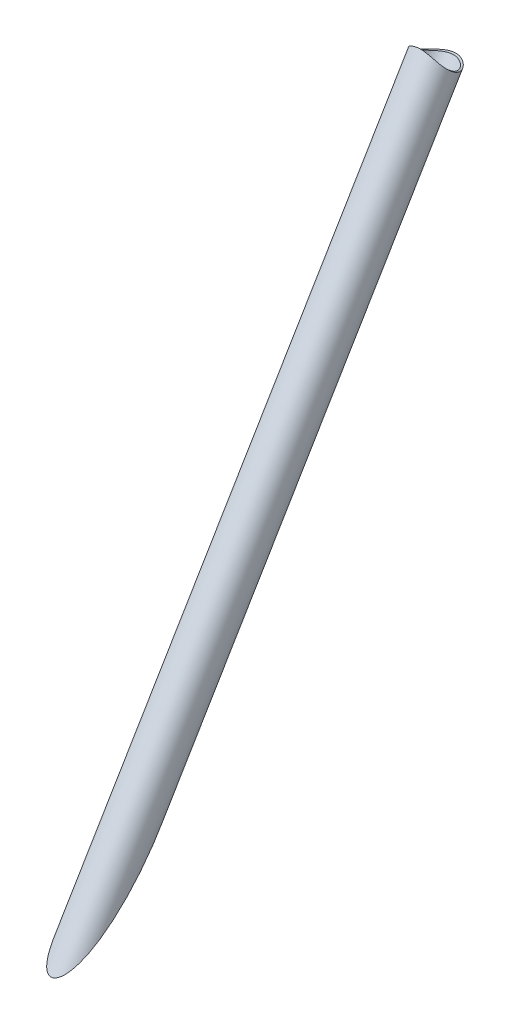
from build123d import *

# Parameters (mm, degrees)
BOSS_EXTRUDE1_OUTLINE_R   = 7.9375
BOSS_EXTRUDE1_OUTLINE_R_2 = 7.2263
BOSS_EXTRUDE1_DEPTH       = 287.964754837
BOSS_EXTRUDE1_START       = -765
BOSS_EXTRUDE1_2_DEPTH     = 284.980617027
CUT_EXTRUDE1_DEPTH        = 1735.634181442
CUT_EXTRUDE1_DEPTH_BACK   = 1735.634181442
SKETCH3_R                 = 12.7


with BuildPart() as part:
    # Boss-Extrude1: read off the stored shape, not the designer's step
    # Boss-Extrude1 outline → Boss-Extrude1 (new body)
    with BuildSketch(Plane(origin=(0, 718.69539577, 1422.4), x_dir=(-1, 0, 0), z_dir=(0, -0.8585455614781596, 0.5127372805503339))):
        Circle(BOSS_EXTRUDE1_OUTLINE_R)
        Circle(BOSS_EXTRUDE1_OUTLINE_R_2, mode=Mode.SUBTRACT)
    extrude(amount=BOSS_EXTRUDE1_DEPTH)

    # Boss-Extrude1 2 outline → Boss-Extrude1 2 (cut)
    with BuildSketch(Plane(origin=(0, 0, 0), x_dir=(1, 0, 0), z_dir=(0, 0.714472679632801, -0.699663340513368)).offset(BOSS_EXTRUDE1_START)):
        with BuildLine():
            ThreePointArc((-7.937568699, -1458.068806452), (-7.371e-06, -1459.340917959), (7.937554695, -1458.068811059))
            Line((7.937554695, -1458.068811059), (9, -1457.719289545))
            Line((9, -1457.719289545), (9, -1442))
            Line((9, -1442), (-9, -1442))
            Line((-9, -1442), (-9, -1457.719288862))
            Line((-9, -1457.719288862), (-7.937568699, -1458.068806452))
        make_face()
    extrude(amount=BOSS_EXTRUDE1_2_DEPTH, mode=Mode.SUBTRACT)

    # Sketch3 → Cut-Extrude1 (cut, two sides: drawn at the far end of the back side and taken through both)
    with BuildSketch(Plane(origin=(0, 0, 0), x_dir=(0, 0, -1), z_dir=(1, 0, 0)).offset(-CUT_EXTRUDE1_DEPTH_BACK)):
        with Locations((-1422.4, 718.69539577)):
            Circle(SKETCH3_R)
    extrude(amount=CUT_EXTRUDE1_DEPTH + CUT_EXTRUDE1_DEPTH_BACK, mode=Mode.SUBTRACT)


solid = part.part
